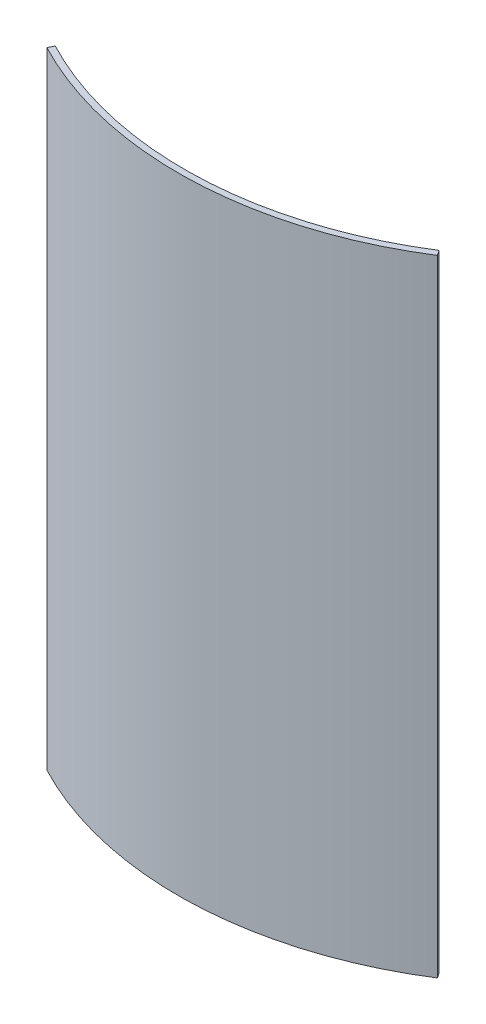
from build123d import *

# Parameters (mm, degrees)
BOSS_EXTRUDE1_DEPTH = 127


with BuildPart() as part:
    # Sketch1 → Boss-Extrude1 (new body)
    with BuildSketch(Plane(origin=(0, 0, 0), x_dir=(1, 0, 0), z_dir=(0, 1, 0))):
        with BuildLine():
            Line((-34.811887815, -66.352372729), (-35.386204999, -67.485231687))
            ThreePointArc((-35.386204999, -67.485231687), (3.097263371, -76.13702752), (40.750822522, -64.387968316))
            Line((40.750822522, -64.387968316), (40.056896478, -63.324165566))
            ThreePointArc((40.056896478, -63.324165566), (3.028207163, -74.868784292), (-34.811887815, -66.352372729))
        make_face()
    extrude(amount=BOSS_EXTRUDE1_DEPTH)


solid = part.part
